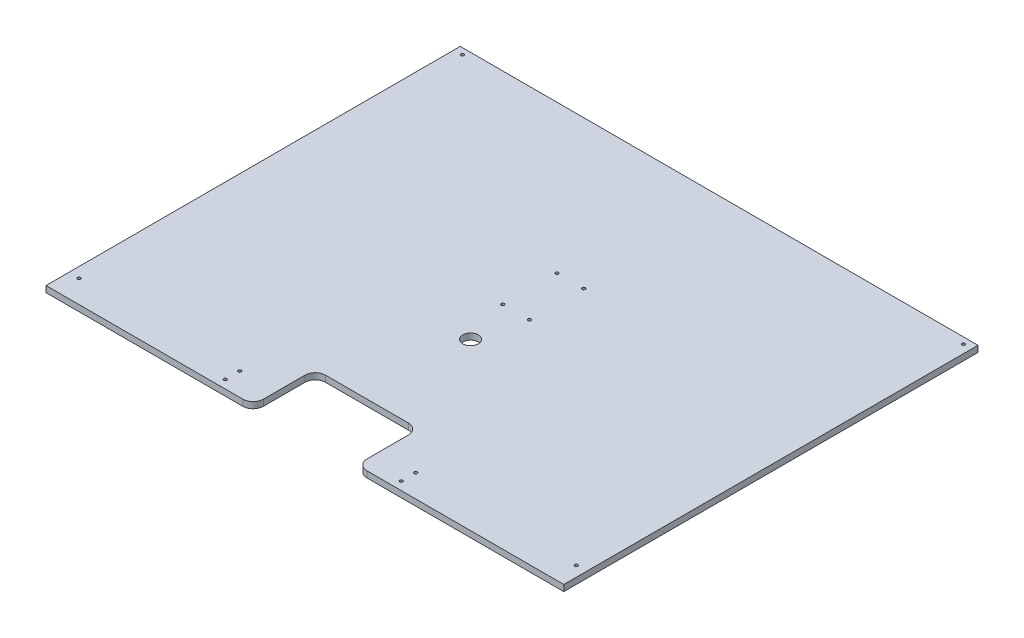
from build123d import *

# Parameters (mm, degrees)
SKETCH1_W           = 500
SKETCH1_H           = 400
SKETCH1_R           = 1.5
SKETCH1_R_2         = 1.525
BOSS_EXTRUDE1_DEPTH = 6
SKETCH2_R           = 1.5
CUT_EXTRUDE1_DEPTH  = 10
SKETCH3_R           = 7.5
SKETCH3_W           = 100
SKETCH3_H           = 60
CUT_EXTRUDE2_DEPTH  = 641.340534403
FILLET1_R           = 10


with BuildPart() as part:
    # Sketch1 → Boss-Extrude1 (new body)
    with BuildSketch(Plane(origin=(0, 0, 0), x_dir=(1, 0, 0), z_dir=(0, 1, 0))):
        with Locations((250, -200)):
            Rectangle(SKETCH1_W, SKETCH1_H)
        with Locations((490, -378)):
            Circle(SKETCH1_R, mode=Mode.SUBTRACT)
        with Locations((10, -378)):
            Circle(SKETCH1_R, mode=Mode.SUBTRACT)
        with Locations((8, -6)):
            Circle(SKETCH1_R, mode=Mode.SUBTRACT)
        with Locations((492, -6)):
            Circle(SKETCH1_R_2, mode=Mode.SUBTRACT)
        with Locations((236.4, -195.2)):
            Circle(SKETCH1_R, mode=Mode.SUBTRACT)
        with Locations((262.1, -195.2)):
            Circle(SKETCH1_R, mode=Mode.SUBTRACT)
        with Locations((262.1, -142.9)):
            Circle(SKETCH1_R, mode=Mode.SUBTRACT)
        with Locations((236.4, -142.9)):
            Circle(SKETCH1_R, mode=Mode.SUBTRACT)
    extrude(amount=BOSS_EXTRUDE1_DEPTH)

    # Sketch2 → Cut-Extrude1 (cut)
    with BuildSketch(Plane(origin=(0, 6, 0), x_dir=(1, 0, 0), z_dir=(0, 1, 0))):
        with Locations((165, -378)):
            Circle(SKETCH2_R)
        with Locations((165, -392)):
            Circle(SKETCH2_R)
        with Locations((335, -378)):
            Circle(SKETCH2_R)
        with Locations((335, -392)):
            Circle(SKETCH2_R)
    extrude(amount=-CUT_EXTRUDE1_DEPTH, mode=Mode.SUBTRACT)

    # Sketch3 → Cut-Extrude2 (cut, through all)
    with BuildSketch(Plane.XZ):
        with Locations((250, 240)):
            Circle(SKETCH3_R)
        with Locations((250, 370)):
            Rectangle(SKETCH3_W, SKETCH3_H)
    extrude(amount=-CUT_EXTRUDE2_DEPTH, mode=Mode.SUBTRACT)

    # Fillet1
    fillet1_edges = [part.edges().sort_by_distance(p)[0] for p in [
        (200, 3, 400),
        (300, 3, 400),
        (200, 3, 340),
        (300, 3, 340),
    ]]
    fillet(fillet1_edges, radius=FILLET1_R)


solid = part.part
